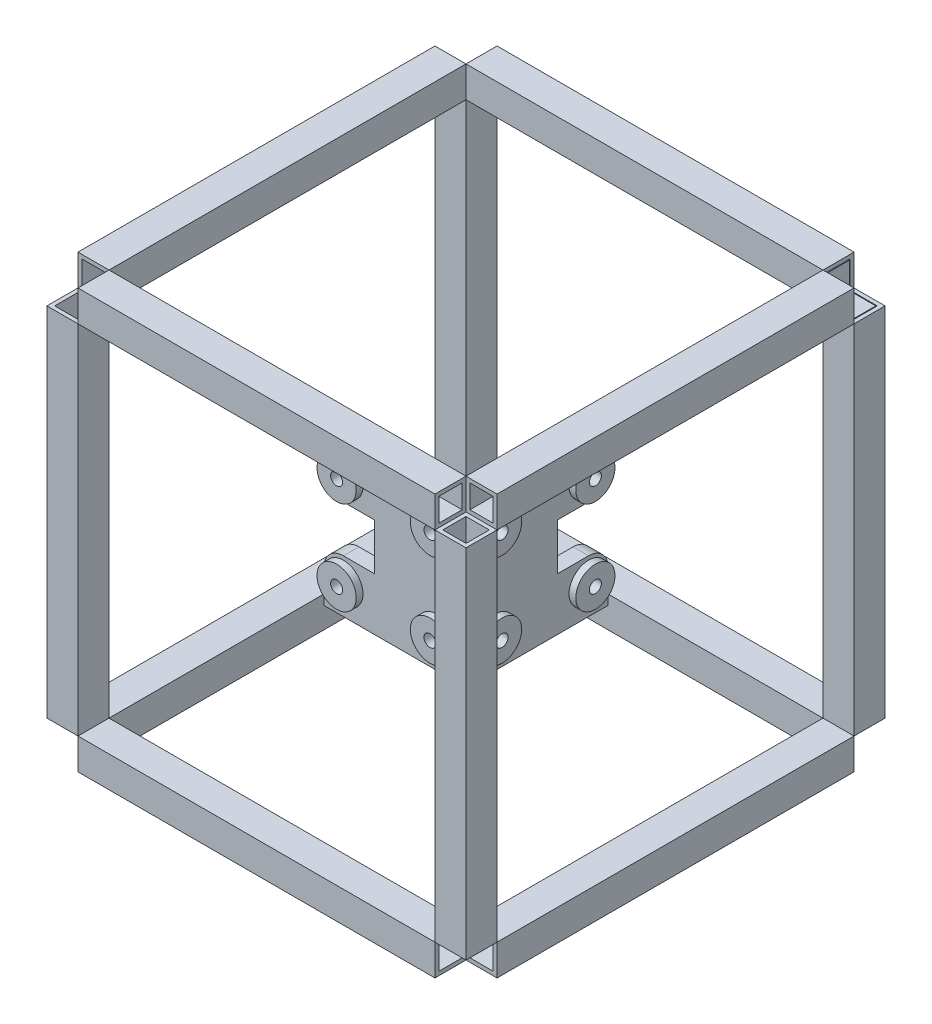
from build123d import *

# Parameters (mm, degrees)
BOSS_EXTRUDE1_START    = -4
SKETCH1_W              = 8
SKETCH1_H              = 8
SKETCH1_W_2            = 6
SKETCH1_H_2            = 6
BOSS_EXTRUDE1_DEPTH    = 92
BOSS_EXTRUDE1_2_DEPTH  = 92
BOSS_EXTRUDE1_3_DEPTH  = 92
BOSS_EXTRUDE1_4_DEPTH  = 92
BOSS_EXTRUDE2_START    = -8
SKETCH9_W              = 8
SKETCH9_H              = 8
SKETCH9_W_2            = 6
SKETCH9_H_2            = 6
BOSS_EXTRUDE2_DEPTH    = 92
BOSS_EXTRUDE2_2_DEPTH  = 92
BOSS_EXTRUDE2_3_DEPTH  = 92
BOSS_EXTRUDE2_4_DEPTH  = 92
BOSS_EXTRUDE3_START    = 8
SKETCH10_W             = 8
SKETCH10_H             = 8
SKETCH10_W_2           = 6
SKETCH10_H_2           = 6
BOSS_EXTRUDE3_DEPTH    = 92
BOSS_EXTRUDE3_2_DEPTH  = 92
BOSS_EXTRUDE3_3_DEPTH  = 92
BOSS_EXTRUDE3_4_DEPTH  = 92
SKETCH11_R             = 5.05
SKETCH11_R_2           = 1.55
BOSS_EXTRUDE13_DEPTH   = 1.75
BOSS_EXTRUDE13_2_DEPTH = 1.75
BOSS_EXTRUDE13_3_DEPTH = 1.75
BOSS_EXTRUDE13_4_DEPTH = 1.75
SKETCH12_R             = 1.55
BOSS_EXTRUDE6_DEPTH    = 4
BODY_MOVE_COPY1_ANGLE  = 180
BODY_MOVE_COPY3_ANGLE  = 120
BOSS_EXTRUDE7_DEPTH    = 36.64081528
CUT_EXTRUDE1_START     = -4
SKETCH18_R             = 1.55
SKETCH18_W             = 13.07081528
SKETCH18_H             = 12
CUT_EXTRUDE1_DEPTH     = 2.499185
CUT_EXTRUDE2_START     = -4
SKETCH19_R             = 1.55
SKETCH19_W             = 13.07081528
SKETCH19_H             = 12
CUT_EXTRUDE2_DEPTH     = 2.499185
FILLET2_R              = 5.05
CHAMFER1_SIZE          = 1.35
SKETCH27_W             = 5.6
SKETCH27_H             = 5.6
BOSS_EXTRUDE14_DEPTH   = 12
SKETCH28_W             = 5.6
SKETCH28_H             = 5.6
BOSS_EXTRUDE15_DEPTH   = 12
SKETCH29_W             = 5.6
SKETCH29_H             = 5.6
BOSS_EXTRUDE16_DEPTH   = 12


with BuildPart() as part:
    # Sketch1 → Boss-Extrude1 (new body)
    with BuildSketch(Plane.XY.offset(50).offset(BOSS_EXTRUDE1_START)):
        with Locations((-50, 50)):
            Rectangle(SKETCH1_W, SKETCH1_H)
        with Locations((-50, 50)):
            Rectangle(SKETCH1_W_2, SKETCH1_H_2, mode=Mode.SUBTRACT)
    extrude(amount=-BOSS_EXTRUDE1_DEPTH)


with BuildPart() as body_2:
    # Sketch1 → Boss-Extrude1 2 (new body)
    with BuildSketch(Plane.XY.offset(50).offset(BOSS_EXTRUDE1_START)):
        with Locations((50, 50)):
            Rectangle(SKETCH1_W, SKETCH1_H)
        with Locations((50, 50)):
            Rectangle(SKETCH1_W_2, SKETCH1_H_2, mode=Mode.SUBTRACT)
    extrude(amount=-BOSS_EXTRUDE1_2_DEPTH)


with BuildPart() as body_3:
    # Sketch1 → Boss-Extrude1 3 (new body)
    with BuildSketch(Plane.XY.offset(50).offset(BOSS_EXTRUDE1_START)):
        with Locations((50, -50)):
            Rectangle(SKETCH1_W, SKETCH1_H)
        with Locations((50, -50)):
            Rectangle(SKETCH1_W_2, SKETCH1_H_2, mode=Mode.SUBTRACT)
    extrude(amount=-BOSS_EXTRUDE1_3_DEPTH)


with BuildPart() as body_4:
    # Sketch1 → Boss-Extrude1 4 (new body)
    with BuildSketch(Plane.XY.offset(50).offset(BOSS_EXTRUDE1_START)):
        with Locations((-50, -50)):
            Rectangle(SKETCH1_W, SKETCH1_H)
        with Locations((-50, -50)):
            Rectangle(SKETCH1_W_2, SKETCH1_H_2, mode=Mode.SUBTRACT)
    extrude(amount=-BOSS_EXTRUDE1_4_DEPTH)


with BuildPart() as body_5:
    # Sketch9 → Boss-Extrude2 (new body)
    with BuildSketch(Plane(origin=(0, -54, 0), x_dir=(0, 0, -1), z_dir=(0, -1, 0)).offset(BOSS_EXTRUDE2_START)):
        with Locations((-50, 50)):
            Rectangle(SKETCH9_W, SKETCH9_H)
        with Locations((-50, 50)):
            Rectangle(SKETCH9_W_2, SKETCH9_H_2, mode=Mode.SUBTRACT)
    extrude(amount=-BOSS_EXTRUDE2_DEPTH)


with BuildPart() as body_6:
    # Sketch9 → Boss-Extrude2 2 (new body)
    with BuildSketch(Plane(origin=(0, -54, 0), x_dir=(0, 0, -1), z_dir=(0, -1, 0)).offset(BOSS_EXTRUDE2_START)):
        with Locations((50, 50)):
            Rectangle(SKETCH9_W, SKETCH9_H)
        with Locations((50, 50)):
            Rectangle(SKETCH9_W_2, SKETCH9_H_2, mode=Mode.SUBTRACT)
    extrude(amount=-BOSS_EXTRUDE2_2_DEPTH)


with BuildPart() as body_7:
    # Sketch9 → Boss-Extrude2 3 (new body)
    with BuildSketch(Plane(origin=(0, -54, 0), x_dir=(0, 0, -1), z_dir=(0, -1, 0)).offset(BOSS_EXTRUDE2_START)):
        with Locations((50, -50)):
            Rectangle(SKETCH9_W, SKETCH9_H)
        with Locations((50, -50)):
            Rectangle(SKETCH9_W_2, SKETCH9_H_2, mode=Mode.SUBTRACT)
    extrude(amount=-BOSS_EXTRUDE2_3_DEPTH)


with BuildPart() as body_8:
    # Sketch9 → Boss-Extrude2 4 (new body)
    with BuildSketch(Plane(origin=(0, -54, 0), x_dir=(0, 0, -1), z_dir=(0, -1, 0)).offset(BOSS_EXTRUDE2_START)):
        with Locations((-50, -50)):
            Rectangle(SKETCH9_W, SKETCH9_H)
        with Locations((-50, -50)):
            Rectangle(SKETCH9_W_2, SKETCH9_H_2, mode=Mode.SUBTRACT)
    extrude(amount=-BOSS_EXTRUDE2_4_DEPTH)


with BuildPart() as body_9:
    # Sketch10 → Boss-Extrude3 (new body)
    with BuildSketch(Plane(origin=(-54, 0, 0), x_dir=(0, -1, 0), z_dir=(1, 0, 0)).offset(BOSS_EXTRUDE3_START)):
        with Locations((-50, 50)):
            Rectangle(SKETCH10_W, SKETCH10_H)
        with Locations((-50, 50)):
            Rectangle(SKETCH10_W_2, SKETCH10_H_2, mode=Mode.SUBTRACT)
    extrude(amount=BOSS_EXTRUDE3_DEPTH)


with BuildPart() as body_10:
    # Sketch10 → Boss-Extrude3 2 (new body)
    with BuildSketch(Plane(origin=(-54, 0, 0), x_dir=(0, -1, 0), z_dir=(1, 0, 0)).offset(BOSS_EXTRUDE3_START)):
        with Locations((50, 50)):
            Rectangle(SKETCH10_W, SKETCH10_H)
        with Locations((50, 50)):
            Rectangle(SKETCH10_W_2, SKETCH10_H_2, mode=Mode.SUBTRACT)
    extrude(amount=BOSS_EXTRUDE3_2_DEPTH)


with BuildPart() as body_11:
    # Sketch10 → Boss-Extrude3 3 (new body)
    with BuildSketch(Plane(origin=(-54, 0, 0), x_dir=(0, -1, 0), z_dir=(1, 0, 0)).offset(BOSS_EXTRUDE3_START)):
        with Locations((50, -50)):
            Rectangle(SKETCH10_W, SKETCH10_H)
        with Locations((50, -50)):
            Rectangle(SKETCH10_W_2, SKETCH10_H_2, mode=Mode.SUBTRACT)
    extrude(amount=BOSS_EXTRUDE3_3_DEPTH)


with BuildPart() as body_12:
    # Sketch10 → Boss-Extrude3 4 (new body)
    with BuildSketch(Plane(origin=(-54, 0, 0), x_dir=(0, -1, 0), z_dir=(1, 0, 0)).offset(BOSS_EXTRUDE3_START)):
        with Locations((-50, -50)):
            Rectangle(SKETCH10_W, SKETCH10_H)
        with Locations((-50, -50)):
            Rectangle(SKETCH10_W_2, SKETCH10_H_2, mode=Mode.SUBTRACT)
    extrude(amount=BOSS_EXTRUDE3_4_DEPTH)


with BuildPart() as body_13:
    # Sketch11 → Boss-Extrude13 (new body)
    with BuildSketch(Plane.ZY.offset(-21.32)):
        with Locations(Location((-12.02081528, 12.02081528, 0), (0, 0, 270))):
            Circle(SKETCH11_R)
        with Locations(Location((-12.02081528, 12.02081528, 0), (0, 0, 270))):
            Circle(SKETCH11_R_2, mode=Mode.SUBTRACT)
    extrude(amount=BOSS_EXTRUDE13_DEPTH)



with BuildPart() as body_14:
    # Sketch11 → Boss-Extrude13 2 (new body)
    with BuildSketch(Plane.ZY.offset(-21.32)):
        with Locations(Location((12.02081528, 12.02081528, 0), (0, 0, 270))):
            Circle(SKETCH11_R)
        with Locations(Location((12.02081528, 12.02081528, 0), (0, 0, 270))):
            Circle(SKETCH11_R_2, mode=Mode.SUBTRACT)
    extrude(amount=BOSS_EXTRUDE13_2_DEPTH)


with BuildPart() as body_15:
    # Sketch11 → Boss-Extrude13 3 (new body)
    with BuildSketch(Plane.ZY.offset(-21.32)):
        with Locations(Location((12.02081528, -12.02081528, 0), (0, 0, 270))):
            Circle(SKETCH11_R)
        with Locations(Location((12.02081528, -12.02081528, 0), (0, 0, 270))):
            Circle(SKETCH11_R_2, mode=Mode.SUBTRACT)
    extrude(amount=BOSS_EXTRUDE13_3_DEPTH)


with BuildPart() as body_16:
    # Sketch11 → Boss-Extrude13 4 (new body)
    with BuildSketch(Plane.ZY.offset(-21.32)):
        with Locations(Location((-12.02081528, -12.02081528, 0), (0, 0, 270))):
            Circle(SKETCH11_R)
        with Locations(Location((-12.02081528, -12.02081528, 0), (0, 0, 270))):
            Circle(SKETCH11_R_2, mode=Mode.SUBTRACT)
    extrude(amount=BOSS_EXTRUDE13_4_DEPTH)


with BuildPart() as body_13_1:
    add(body_13.part)

    add(body_14.part)  # Boss-Extrude6 merges body 14

    add(body_15.part)  # Boss-Extrude6 merges body 15

    add(body_16.part)  # Boss-Extrude6 merges body 16
    # Sketch12 → Boss-Extrude6 (add)
    with BuildSketch(Plane.ZY.offset(-19.57)):
        Polygon((17.07081528, -17.07081528), (17.07081528, 17.07081528), (-17.07081528, 17.07081528), (-17.07081528, 6), (-4, 6), (-4, -6), (-17.07081528, -6), (-17.07081528, -17.07081528), align=None)
        with Locations(Location((-12.02081528, -12.02081528, 0), (0, 0, 270))):
            Circle(SKETCH12_R, mode=Mode.SUBTRACT)
        with Locations(Location((12.02081528, -12.02081528, 0), (0, 0, 270))):
            Circle(SKETCH12_R, mode=Mode.SUBTRACT)
        with Locations(Location((12.02081528, 12.02081528, 0), (0, 0, 270))):
            Circle(SKETCH12_R, mode=Mode.SUBTRACT)
        with Locations(Location((-12.02081528, 12.02081528, 0), (0, 0, 270))):
            Circle(SKETCH12_R, mode=Mode.SUBTRACT)
    extrude(amount=BOSS_EXTRUDE6_DEPTH)


with BuildPart() as body_14_2:
    # Body-Move/Copy1: copy of body 13
    add(body_13_1.part.moved(Location((0, 0, 0))).rotate(Axis((9.285, 0, -9.285), (0.7071067811865488, 0, 0.7071067811865462)), BODY_MOVE_COPY1_ANGLE))


with BuildPart() as body_14_2_1:
    # Body-Move/Copy2: moved
    add(body_14_2.part.moved(Location((-18.57, 0, 18.57))))


with BuildPart() as body_15_2:
    # Body-Move/Copy3: copy of body 14 2
    add(body_14_2_1.part.moved(Location((0, 0, 0))).rotate(Axis((-6.19, 6.19, 12.38), (0.5773502691896252, -0.5773502691896252, 0.5773502691896272)), BODY_MOVE_COPY3_ANGLE))


with BuildPart() as body_15_2_1:
    # Body-Move/Copy4: moved
    add(body_15_2.part.moved(Location((0, -18.57, -18.57))))

    # Combine1: union body 14 2, body 13
    add(body_14_2_1.part)
    add(body_13_1.part)

    # Sketch13 → Boss-Extrude7 (add)
    with BuildSketch(Plane.XZ.offset(19.57)):
        Polygon((19.57, 19.57), (-17.07081528, 19.57), (-17.07081528, 17.07081528), (17.07081528, 17.07081528), (17.07081528, -17.07081528), (19.57, -17.07081528), (19.57, 17.07081528), align=None)
    extrude(amount=-BOSS_EXTRUDE7_DEPTH)

    # Sketch18 → Cut-Extrude1 (cut)
    with BuildSketch(Plane(origin=(0, 0, 15.57), x_dir=(-1, 0, 0), z_dir=(0, 0, -1)).offset(CUT_EXTRUDE1_START)):
        with Locations(Location((-12.02081528, 12.02081528, 0), (0, 0, 90))):
            Circle(SKETCH18_R)
        with Locations(Location((12.02081528, 12.02081528, 0), (0, 0, 90))):
            Circle(SKETCH18_R)
        with Locations(Location((12.02081528, -12.02081528, 0), (0, 0, 90))):
            Circle(SKETCH18_R)
        with Locations(Location((-12.02081528, -12.02081528, 0), (0, 0, 90))):
            Circle(SKETCH18_R)
        with Locations((10.53540764, 0)):
            Rectangle(SKETCH18_W, SKETCH18_H)
    extrude(amount=CUT_EXTRUDE1_DEPTH, mode=Mode.SUBTRACT)

    # Sketch19 → Cut-Extrude2 (cut)
    with BuildSketch(Plane.ZY.offset(-15.57).offset(CUT_EXTRUDE2_START)):
        with Locations(Location((-12.02081528, 12.02081528, 0), (0, 0, 270))):
            Circle(SKETCH19_R)
        with Locations(Location((12.02081528, 12.02081528, 0), (0, 0, 270))):
            Circle(SKETCH19_R)
        with Locations(Location((12.02081528, -12.02081528, 0), (0, 0, 270))):
            Circle(SKETCH19_R)
        with Locations(Location((-12.02081528, -12.02081528, 0), (0, 0, 270))):
            Circle(SKETCH19_R)
        with Locations((-10.53540764, 0)):
            Rectangle(SKETCH19_W, SKETCH19_H)
    extrude(amount=CUT_EXTRUDE2_DEPTH, mode=Mode.SUBTRACT)

    # Fillet2
    fillet2_edges = [body_15_2_1.edges().sort_by_distance(p)[0] for p in [
        (17.57, -6, -17.07081528),
        (-17.07081528, 6, 17.57),
        (-17.07081528, 17.07081528, 17.57),
        (-17.07081528, -6, 17.57),
        (17.57, 17.07081528, -17.07081528),
        (17.57, 6, -17.07081528),
        (-6, -17.57, -17.07081528),
        (-17.07081528, -17.57, -17.07081528),
        (6, -17.57, -17.07081528),
    ]]
    fillet(fillet2_edges, radius=FILLET2_R - 0.0001)  # a hair under: the kernel refuses the full size

    # Chamfer1
    chamfer1_edges = [body_15_2_1.edges().sort_by_distance(p)[0] for p in [
        (-12.02081528, 10.47081528, 15.57),
        (12.02081528, 10.47081528, 15.57),
        (12.02081528, -13.57081528, 15.57),
        (-12.02081528, -13.57081528, 15.57),
        (15.57, -10.47081528, -12.02081528),
        (15.57, -10.47081528, 12.02081528),
        (15.57, 13.57081528, 12.02081528),
        (15.57, 13.57081528, -12.02081528),
        (-10.47081528, -15.57, -12.02081528),
        (-10.47081528, -15.57, 12.02081528),
        (13.57081528, -15.57, 12.02081528),
        (13.57081528, -15.57, -12.02081528),
    ]]
    chamfer(chamfer1_edges, length=CHAMFER1_SIZE)


with BuildPart() as body_14_3:
    # Sketch27 → Boss-Extrude14 (new body)
    with BuildSketch(Plane(origin=(0, 0, -46), x_dir=(-1, 0, 0), z_dir=(0, 0, -1))):
        with Locations((-50, 50)):
            Rectangle(SKETCH27_W, SKETCH27_H)
    extrude(amount=-BOSS_EXTRUDE14_DEPTH)


with BuildPart() as body_15_3:
    # Sketch28 → Boss-Extrude15 (new body)
    with BuildSketch(Plane(origin=(0, 46, 0), x_dir=(1, 0, 0), z_dir=(0, 1, 0))):
        with Locations((50, 50)):
            Rectangle(SKETCH28_W, SKETCH28_H)
    extrude(amount=-BOSS_EXTRUDE15_DEPTH)


with BuildPart() as body_16_2:
    # Sketch29 → Boss-Extrude16 (new body)
    with BuildSketch(Plane(origin=(46, 0, 0), x_dir=(0, 0, -1), z_dir=(1, 0, 0))):
        with Locations((50, 50)):
            Rectangle(SKETCH29_W, SKETCH29_H)
    extrude(amount=-BOSS_EXTRUDE16_DEPTH)


solid = Compound([part.part, body_2.part, body_3.part, body_4.part, body_5.part, body_6.part, body_7.part, body_8.part, body_9.part, body_10.part, body_11.part, body_12.part, body_15_2_1.part, body_14_3.part, body_15_3.part, body_16_2.part])
